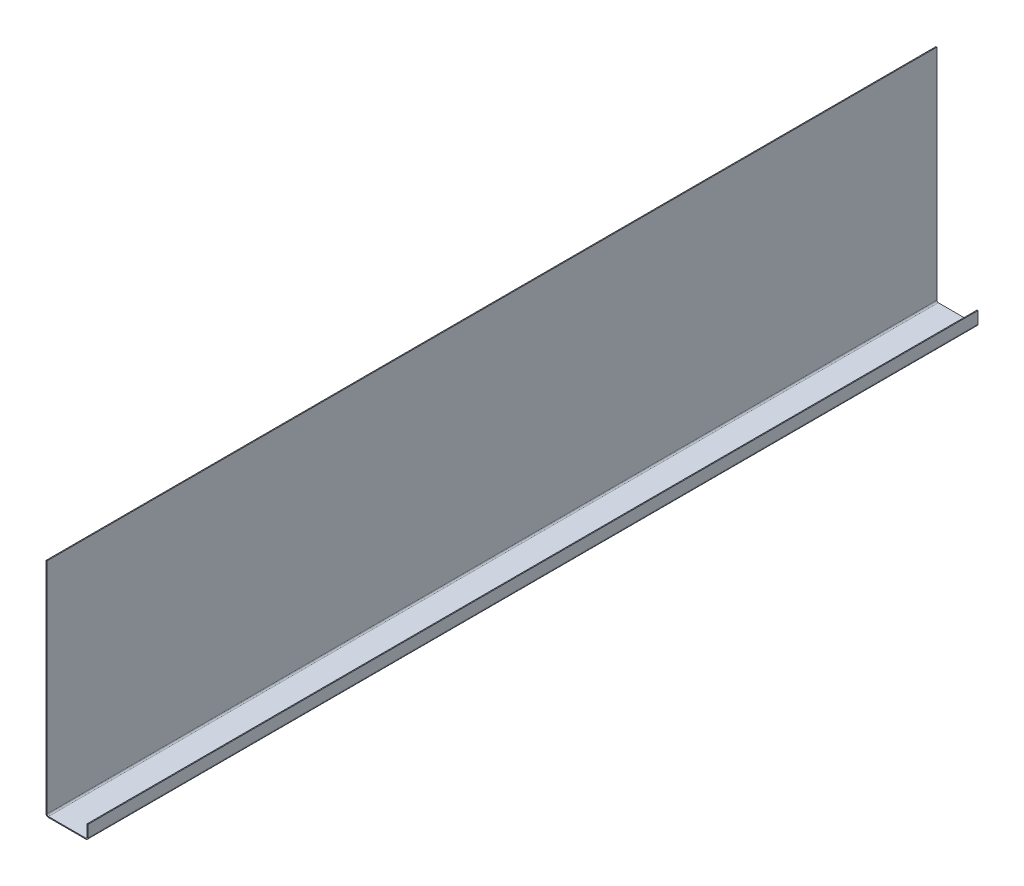
from build123d import *

# Parameters (mm, degrees)
BASE_FLANGE1_DEPTH = 1205


# Sheet-metal steps are written as plain solids
with BuildPart() as part:
    # Sketch1 → Base-Flange1 (new body)
    with BuildSketch(Plane.XY):
        with BuildLine():
            Line((0, 300), (0, 3.25))
            ThreePointArc((0, 3.25), (0.951902961, 0.951902961), (3.25, 0))
            Line((3.25, 0), (53.75, 0))
            ThreePointArc((53.75, 0), (56.048097039, 0.951902961), (57, 3.25))
            Line((57, 3.25), (57, 19))
            Line((57, 19), (55.75, 19))
            Line((55.75, 19), (55.75, 3.25))
            ThreePointArc((55.75, 3.25), (55.164213562, 1.835786438), (53.75, 1.25))
            Line((53.75, 1.25), (3.25, 1.25))
            ThreePointArc((3.25, 1.25), (1.835786438, 1.835786438), (1.25, 3.25))
            Line((1.25, 3.25), (1.25, 300))
            Line((1.25, 300), (0, 300))
        make_face()
    extrude(amount=BASE_FLANGE1_DEPTH)


solid = part.part
